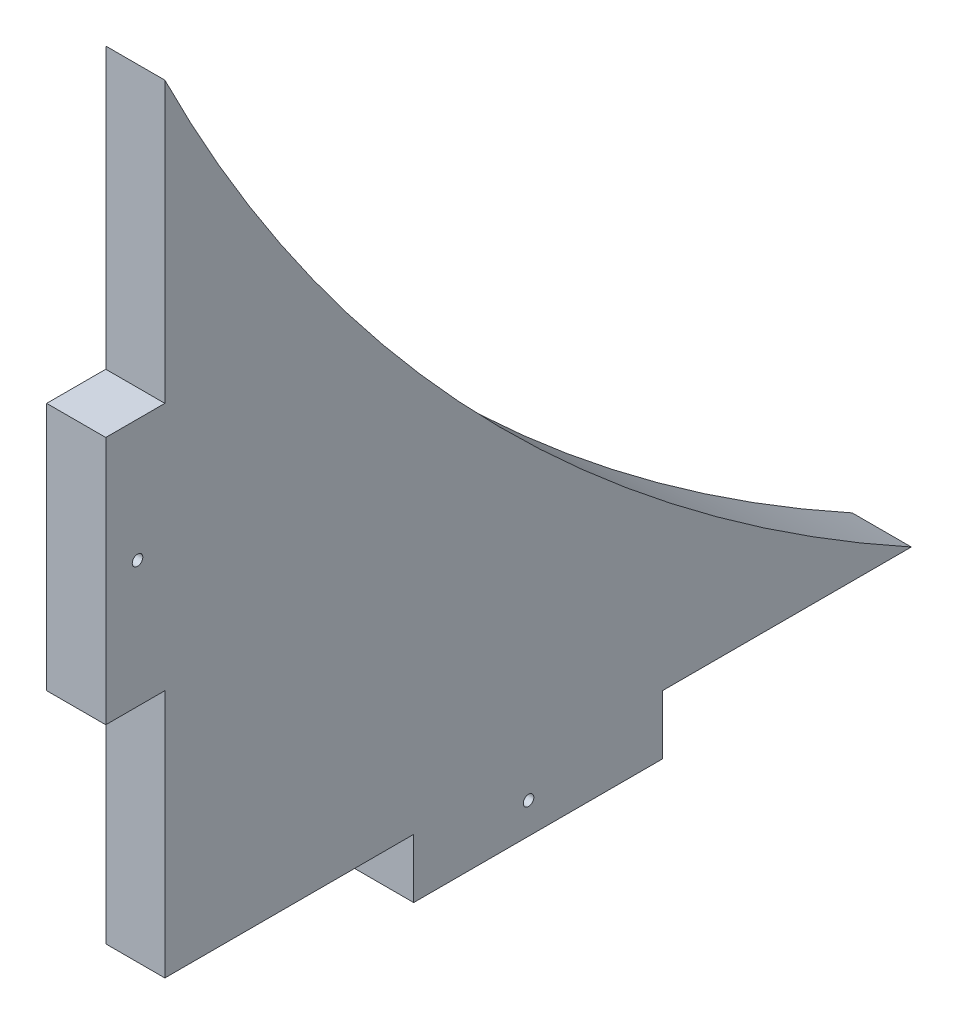
from build123d import *

# Parameters (mm, degrees)
BOSS_EXTRUDE1_DEPTH  = 19
SKETCH2_W            = 19
SKETCH2_H            = 80
BOSS_EXTRUDE2_DEPTH  = 19
SKETCH3_W            = 19
SKETCH3_H            = 80
BOSS_EXTRUDE3_DEPTH  = 19
M3_CLEARANCE_HOLE1_D = 3.4


with BuildPart() as part:
    # Sketch1 → Boss-Extrude1 (new body)
    with BuildSketch(Plane(origin=(0, 0, 0), x_dir=(0, 0, -1), z_dir=(1, 0, 0))):
        with BuildLine():
            Line((-143.772893773, 109.432234432), (-143.772893773, -140.567765568))
            Line((-143.772893773, -140.567765568), (96.227106227, -140.567765568))
            ThreePointArc((96.227106227, -140.567765568), (-42.958076814, -33.985541287), (-143.772893773, 109.432234432))
        make_face()
    extrude(amount=BOSS_EXTRUDE1_DEPTH)

    # Sketch2 → Boss-Extrude2 (add)
    with BuildSketch(Plane.XZ.offset(140.567765568)):
        with Locations((9.5, 23.772893773)):
            Rectangle(SKETCH2_W, SKETCH2_H)
    extrude(amount=BOSS_EXTRUDE2_DEPTH)

    # Sketch3 → Boss-Extrude3 (add)
    with BuildSketch(Plane.XY.offset(143.772893773)):
        with Locations((9.5, -20.567765568)):
            Rectangle(SKETCH3_W, SKETCH3_H)
    extrude(amount=BOSS_EXTRUDE3_DEPTH)

    # M3 Clearance Hole1 (through all)
    with Locations(Plane(origin=(19, -19.846414317, 152.560687726), x_dir=(0, 0, 1), z_dir=(1, 0, 0))):
        with Locations((0, 0), (-125.714072415, 129.730496454)):
            Hole(M3_CLEARANCE_HOLE1_D / 2)


solid = part.part
